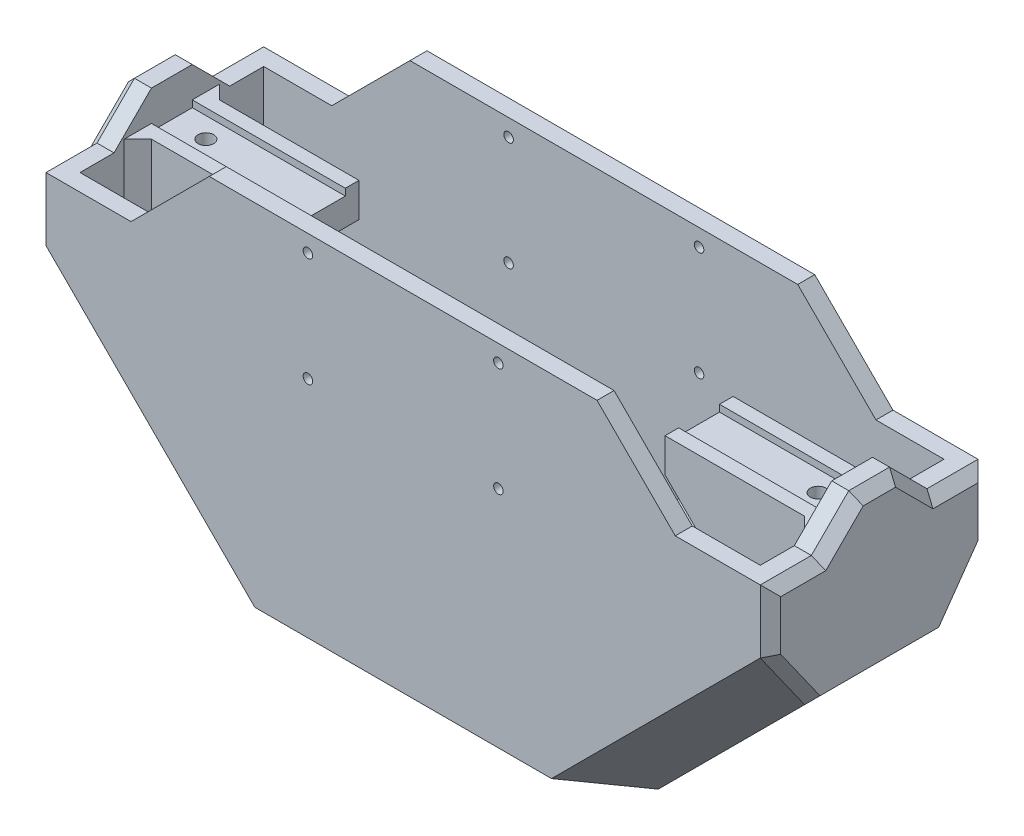
from build123d import *

# Parameters (mm, degrees)
SKETCH1_W                  = 200
SKETCH1_H                  = 54
BOSS_EXTRUDE1_DEPTH        = 75
SHELL1_T                   = 5
BOSS_EXTRUDE2_DEPTH        = 5
BOSS_EXTRUDE3_DEPTH        = 5
SKETCH3_R                  = 1.4
CUT_EXTRUDE1_DEPTH         = 6
BOSS_EXTRUDE4_DEPTH        = 10
SKETCH9_W                  = 45
SKETCH9_H                  = 20
BOSS_EXTRUDE6_DEPTH        = 2
CUT_EXTRUDE2_REACH         = 231.462
SKETCH10_W                 = 12
SKETCH10_H                 = 2
SKETCH11_R                 = 2.3
CUT_EXTRUDE3_DEPTH         = 6
SKETCH13_W                 = 10.5
SKETCH13_H                 = 15
BOSS_EXTRUDE8_DEPTH        = 27
BOSS_EXTRUDE9_DEPTH        = 3.2
CUT_EXTRUDE4_REACH         = 130.496
SKETCH15_R                 = 1.4
CHAMFER8_SIZE              = 0.5
CHAMFER8_OF_MIRROR6_SIZE   = 0.5
CHAMFER3_SIZE              = 40
CHAMFER5_SIZE              = 43
CHAMFER9_SIZE              = 5
CHAMFER10_SIZE             = 2
CHAMFER11_SIZE             = 10
CHAMFER12_SIZE             = 13
CHAMFER13_SIZE             = 4
BOSS_EXTRUDE10_DEPTH       = 3
CHAMFER14_SIZE             = 3
CHAMFER14_OF_MIRROR28_SIZE = 3


# Some blends are built 0.0001 mm under size
with BuildPart() as part:
    # Sketch1 → Boss-Extrude1 (new body)
    with BuildSketch(Plane(origin=(0, 0, 0), x_dir=(1, 0, 0), z_dir=(0, 1, 0))):
        Rectangle(SKETCH1_W, SKETCH1_H)
    extrude(amount=BOSS_EXTRUDE1_DEPTH)

    # Shell1
    shell1_openings = [part.faces().sort_by_distance(p)[0] for p in [
        (0, 75, 0),
    ]]
    offset(amount=SHELL1_T, openings=shell1_openings, kind=Kind.INTERSECTION)

    # Sketch2 → Boss-Extrude2 (add)
    with BuildSketch(Plane(origin=(105, 0, 0), x_dir=(0, 0, -1), z_dir=(1, 0, 0))):
        Polygon((-17, 75), (-6, 86), (6, 86), (17, 75), align=None)
    boss_extrude2 = extrude(amount=-BOSS_EXTRUDE2_DEPTH)

    # Sketch4 → Boss-Extrude3 (add)
    with BuildSketch(Plane(origin=(0, 0, -32), x_dir=(-1, 0, 0), z_dir=(0, 0, -1))):
        Polygon((-80, 75), (-57, 98), (57, 98), (80, 75), align=None)
    boss_extrude3 = extrude(amount=-BOSS_EXTRUDE3_DEPTH)

    # Sketch3 → Cut-Extrude1 (cut)
    with BuildSketch(Plane(origin=(0, 0, -32), x_dir=(-1, 0, 0), z_dir=(0, 0, -1))):
        with Locations((-28, 93)):
            Circle(SKETCH3_R)
        with Locations((-28, 61)):
            Circle(SKETCH3_R)
        with Locations((28, 93)):
            Circle(SKETCH3_R)
        with Locations((28, 61)):
            Circle(SKETCH3_R)
    cut_extrude1 = extrude(amount=-CUT_EXTRUDE1_DEPTH, mode=Mode.SUBTRACT)

    # Mirror4: Boss-Extrude3, Cut-Extrude1 across plane
    add(boss_extrude3.mirror(Plane.XY))
    add(cut_extrude1.mirror(Plane.XY), mode=Mode.SUBTRACT)

    # Mirror5: Boss-Extrude2 across plane
    add(boss_extrude2.mirror(Plane(origin=(0, 0, 0), x_dir=(0, 0, 1), z_dir=(1, 0, 0))))

    # Sketch5 → Boss-Extrude4 (add, symmetric)
    with BuildSketch(Plane.XY):
        Polygon((-100, 75), (-55, 75), (-55, 67), (-100, 22), align=None)
    boss_extrude4 = extrude(amount=BOSS_EXTRUDE4_DEPTH, both=True)

    # Sketch9 → Boss-Extrude6 (add)
    with BuildSketch(Plane(origin=(0, 75, 0), x_dir=(1, 0, 0), z_dir=(0, 1, 0))):
        with Locations((-77.5, 0)):
            Rectangle(SKETCH9_W, SKETCH9_H)
    boss_extrude6 = extrude(amount=BOSS_EXTRUDE6_DEPTH)

    # Sketch10 → Cut-Extrude2 (cut, up to next)
    with BuildSketch(Plane(origin=(-100, 0, 0), x_dir=(0, 0, -1), z_dir=(1, 0, 0)), mode=Mode.PRIVATE) as cut_extrude2_sk1:
        with Locations((0, 76)):
            Rectangle(SKETCH10_W, SKETCH10_H)
    cut_extrude2_tool1 = extrude(cut_extrude2_sk1.sketch, amount=CUT_EXTRUDE2_REACH, mode=Mode.PRIVATE) & part.part
    cut_extrude2 = cut_extrude2_tool1.solids().sort_by_distance((-100, 76, 0))[0]
    add(cut_extrude2, mode=Mode.SUBTRACT)

    # Sketch11 → Cut-Extrude3 (cut)
    with BuildSketch(Plane(origin=(0, 75, 0), x_dir=(1, 0, 0), z_dir=(0, 1, 0))):
        with Locations(Location((-90, 0, 0), (0, 0, 270))):
            Circle(SKETCH11_R)
    cut_extrude3 = extrude(amount=-CUT_EXTRUDE3_DEPTH, mode=Mode.SUBTRACT)

    # Mirror24: Boss-Extrude4, Boss-Extrude6, Cut-Extrude2, Cut-Extrude3 across plane
    add(boss_extrude4.mirror(Plane(origin=(0, 0, 0), x_dir=(0, 0, 1), z_dir=(1, 0, 0))))
    add(boss_extrude6.mirror(Plane(origin=(0, 0, 0), x_dir=(0, 0, 1), z_dir=(1, 0, 0))))
    add(cut_extrude2.mirror(Plane(origin=(0, 0, 0), x_dir=(0, 0, 1), z_dir=(1, 0, 0))), mode=Mode.SUBTRACT)
    add(cut_extrude3.mirror(Plane(origin=(0, 0, 0), x_dir=(0, 0, 1), z_dir=(1, 0, 0))), mode=Mode.SUBTRACT)

    # Sketch13 → Boss-Extrude8 (add, symmetric)
    with BuildSketch(Plane.XY):
        with Locations((35.75, 23.7)):
            Rectangle(SKETCH13_W, SKETCH13_H)
        with Locations((-15.75, 23.7)):
            Rectangle(SKETCH13_W, SKETCH13_H)
    extrude(amount=BOSS_EXTRUDE8_DEPTH, both=True)

    # Sketch14 → Boss-Extrude9 (add)
    with BuildSketch(Plane(origin=(0, 31.2, 0), x_dir=(1, 0, 0), z_dir=(0, 1, 0))):
        with BuildLine():
            Line((-10.5, -27), (-10.5, -9.6))
            Line((-10.5, -9.6), (-15.5, -9.6))
            ThreePointArc((-15.5, -9.6), (-16.914213562, -9.014213562), (-17.5, -7.6))
            Line((-17.5, -7.6), (-17.5, 7.6))
            ThreePointArc((-17.5, 7.6), (-16.914213562, 9.014213562), (-15.5, 9.6))
            Line((-15.5, 9.6), (-10.5, 9.6))
            Line((-10.5, 9.6), (-10.5, 27))
            Line((-10.5, 27), (-21, 27))
            Line((-21, 27), (-21, -27))
            Line((-21, -27), (-10.5, -27))
        make_face()
    boss_extrude9 = extrude(amount=BOSS_EXTRUDE9_DEPTH)

    # Sketch15 → Cut-Extrude4 (cut, up to next)
    with BuildSketch(Plane(origin=(0, 31.2, 0), x_dir=(1, 0, 0), z_dir=(0, 1, 0)), mode=Mode.PRIVATE) as cut_extrude4_sk1:
        with Locations(Location((-14.8, 5, 0), (0, 0, 180))):
            Circle(SKETCH15_R)
    cut_extrude4_tool1 = extrude(cut_extrude4_sk1.sketch, amount=-CUT_EXTRUDE4_REACH, mode=Mode.PRIVATE) & part.part
    # Sketch15 → Cut-Extrude4 (cut, up to next)
    with BuildSketch(Plane(origin=(0, 31.2, 0), x_dir=(1, 0, 0), z_dir=(0, 1, 0)), mode=Mode.PRIVATE) as cut_extrude4_sk2:
        with Locations(Location((-14.8, -5, 0), (0, 0, 180))):
            Circle(SKETCH15_R)
    cut_extrude4_tool2 = extrude(cut_extrude4_sk2.sketch, amount=-CUT_EXTRUDE4_REACH, mode=Mode.PRIVATE) & part.part
    cut_extrude4_1 = cut_extrude4_tool1.solids().sort_by_distance((-14.8, 31.2, -5))[0]
    add(cut_extrude4_1, mode=Mode.SUBTRACT)
    cut_extrude4_2 = cut_extrude4_tool2.solids().sort_by_distance((-14.8, 31.2, 5))[0]
    add(cut_extrude4_2, mode=Mode.SUBTRACT)
    cut_extrude4 = cut_extrude4_1 + cut_extrude4_2  # Cut-Extrude4 as one shape, for the pattern or mirror that repeats it

    # Chamfer8
    chamfer8_edges = [part.edges().sort_by_distance(p)[0] for p in [
        (-13.4, 31.2, -5),
        (-13.4, 31.2, 5),
    ]]
    chamfer(chamfer8_edges, length=CHAMFER8_SIZE)

    # Mirror6: Boss-Extrude9, Cut-Extrude4 across plane
    add(boss_extrude9.mirror(Plane(origin=(10, 0, 0), x_dir=(0, 0, 1), z_dir=(1, 0, 0))))
    add(cut_extrude4.mirror(Plane(origin=(10, 0, 0), x_dir=(0, 0, 1), z_dir=(1, 0, 0))), mode=Mode.SUBTRACT)

    # Chamfer8 of Mirror6
    chamfer8_of_mirror6_edges = [part.edges().sort_by_distance(p)[0] for p in [
        (33.4, 31.2, -5),
        (33.4, 31.2, 5),
    ]]
    chamfer(chamfer8_of_mirror6_edges, length=CHAMFER8_OF_MIRROR6_SIZE)

    # Chamfer3
    # the kernel refuses this chamfer: 40 mm, written as the material it adds along each edge
    with BuildSketch(Plane(origin=(100, 0, 27), x_dir=(0.027495876610586317, 0.9996219169112968, 0), z_dir=(0, 0, -1)), Plane(origin=(-100, 0, -27), x_dir=(-0.027495876610586317, 0.9996219169112968, 0), z_dir=(0, 0, 1))) as chamfer3_piece_1:
        Polygon((CHAMFER3_SIZE * 0.999621916911, -CHAMFER3_SIZE * 0.0274958766106), (-CHAMFER3_SIZE * 0.0274958766106, -CHAMFER3_SIZE * 0.999621916911), (0, 0), align=None)
    extrude(amount=54)

    # Chamfer5
    chamfer5_edges = [part.edges().sort_by_distance(p)[0] for p in [
        (-105, -5, 0),
        (105, -5, 0),
    ]]
    chamfer(chamfer5_edges, length=CHAMFER5_SIZE)

    # Chamfer9
    chamfer9_edges = [part.edges().sort_by_distance(p)[0] for p in [
        (35.75, 16.2, -27),
        (35.75, 16.2, 27),
        (-15.75, 16.2, -27),
        (-15.75, 16.2, 27),
    ]]
    chamfer(chamfer9_edges, length=CHAMFER9_SIZE)

    # Chamfer10
    chamfer10_edges = [part.edges().sort_by_distance(p)[0] for p in [
        (30.5, 22.8, -27),
        (41, 22.8, -27),
        (30.5, 22.8, 27),
        (41, 22.8, 27),
        (-10.5, 22.8, 27),
        (-21, 22.8, 27),
        (-10.5, 22.8, -27),
        (-21, 22.8, -27),
    ]]
    chamfer(chamfer10_edges, length=CHAMFER10_SIZE)

    # Chamfer11
    chamfer11_edges = [part.edges().sort_by_distance(p)[0] for p in [
        (-80, 20, -27),
        (80, 20, -27),
        (-80, 20, 27),
        (80, 20, 27),
    ]]
    chamfer(chamfer11_edges, length=CHAMFER11_SIZE)

    # Chamfer12
    chamfer12_edges = [part.edges().sort_by_distance(p)[0] for p in [
        (-83.5, 16.5, -32),
        (83.5, 16.5, -32),
        (-83.5, 16.5, 32),
        (83.5, 16.5, 32),
    ]]
    chamfer(chamfer12_edges, length=CHAMFER12_SIZE)

    # Chamfer13
    chamfer13_edges = [part.edges().sort_by_distance(p)[0] for p in [
        (-100, 58.5, -10),
        (-100, 58.5, 10),
        (100, 58.5, 10),
        (100, 58.5, -10),
    ]]
    chamfer(chamfer13_edges, length=CHAMFER13_SIZE)

    # Sketch16 → Boss-Extrude10 (add)
    with BuildSketch(Plane(origin=(105, 0, 0), x_dir=(0, 0, -1), z_dir=(1, 0, 0))):
        Polygon((-19, 38), (19, 38), (32, 56.384776311), (32, 75), (17, 75), (6, 86), (-6, 86), (-17, 75), (-32, 75), (-32, 56.384776311), align=None)
    boss_extrude10 = extrude(amount=BOSS_EXTRUDE10_DEPTH)

    # Chamfer14
    chamfer14_edges = [part.edges().sort_by_distance(p)[0] for p in [
        (108, 65.692388155, 32),
        (108, 75, 24.5),
        (108, 80.5, 11.5),
        (108, 86, 0),
        (108, 80.5, -11.5),
        (108, 75, -24.5),
        (108, 65.692388155, -32),
        (108, 47.192388155, -25.5),
        (108, 38, 0),
        (108, 47.192388155, 25.5),
    ]]
    chamfer(chamfer14_edges, length=CHAMFER14_SIZE - 0.0001)  # a hair under: the kernel refuses the full size

    # Mirror28: Boss-Extrude10 across plane
    add(boss_extrude10.mirror(Plane(origin=(0, 0, 0), x_dir=(0, 0, 1), z_dir=(1, 0, 0))))

    # Chamfer14 of Mirror28
    chamfer14_of_mirror28_edges = [part.edges().sort_by_distance(p)[0] for p in [
        (-108, 65.692388155, 32),
        (-108, 75, 24.5),
        (-108, 80.5, 11.5),
        (-108, 86, 0),
        (-108, 80.5, -11.5),
        (-108, 75, -24.5),
        (-108, 65.692388155, -32),
        (-108, 47.192388155, -25.5),
        (-108, 38, 0),
        (-108, 47.192388155, 25.5),
    ]]
    chamfer(chamfer14_of_mirror28_edges, length=CHAMFER14_OF_MIRROR28_SIZE - 0.0001)  # a hair under: the kernel refuses the full size


solid = part.part
